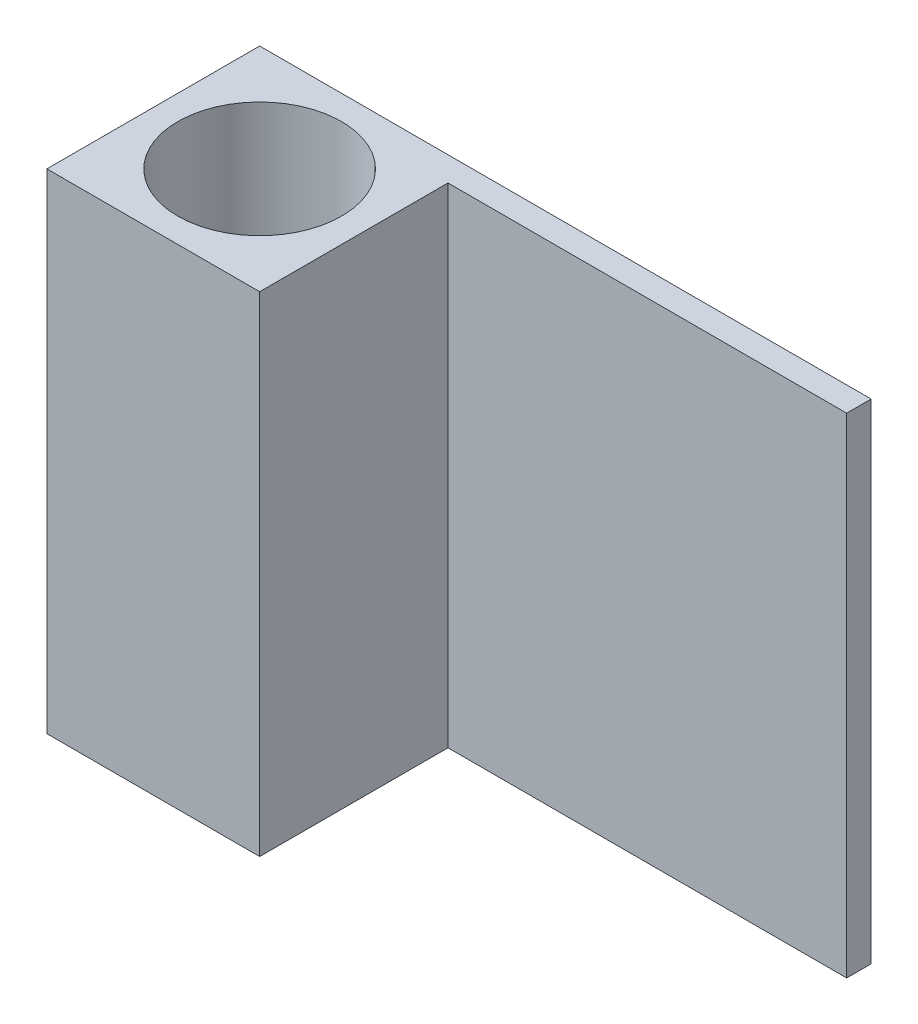
from build123d import *

# Parameters (mm, degrees)
SKETCH1_R           = 13.4
BOSS_EXTRUDE1_DEPTH = 80


with BuildPart() as part:
    # Sketch1 → Boss-Extrude1 (new body)
    with BuildSketch(Plane(origin=(0, 0, 0), x_dir=(1, 0, 0), z_dir=(0, 1, 0))):
        Polygon((17.4, 17.4), (-17.4, 17.4), (-17.4, -17.4), (17.4, -17.4), (17.4, 13.4), (82.6, 13.4), (82.6, 17.4), align=None)
        Circle(SKETCH1_R, mode=Mode.SUBTRACT)
    extrude(amount=BOSS_EXTRUDE1_DEPTH)


solid = part.part
